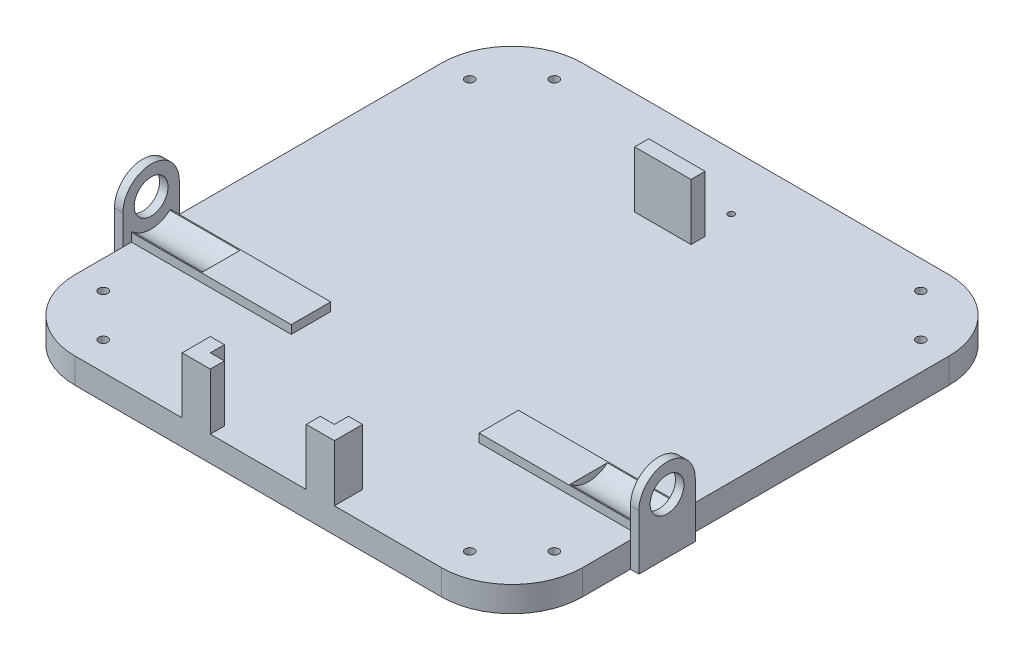
from build123d import *

# Parameters (mm, degrees)
PLATE_DEPTH          = 9
SKETCH2_R            = 1.09
CASTER_HOLES_DEPTH   = 128.597021909
SKETCH3_R            = 1.6
HEX_HOLES_DEPTH      = 128.597021909
SKETCH4_W            = 20
SKETCH4_H            = 5
BATTERY_HOLDER_DEPTH = 20
SKETCH5_W            = 56.7
SKETCH5_H            = 14
BOSS_EXTRUDE2_DEPTH  = 3
SKETCH6_R            = 10
CUT_EXTRUDE1_DEPTH   = 24.8
CUT_EXTRUDE2_START   = -24.8
SKETCH7_R            = 10
CUT_EXTRUDE2_DEPTH   = 24.8
SKETCH8_R            = 6
BOSS_EXTRUDE4_DEPTH  = 3
BOSS_EXTRUDE5_START  = 3
SKETCH9_R            = 6
BOSS_EXTRUDE5_DEPTH  = 3


with BuildPart() as part:
    # Sketch1 → Plate (new body)
    with BuildSketch(Plane(origin=(0, 0, 0), x_dir=(1, 0, 0), z_dir=(0, 1, 0))):
        with BuildLine():
            Line((-65, -90), (65, -90))
            ThreePointArc((65, -90), (82.67766953, -82.67766953), (90, -65))
            Line((90, -65), (90, 65))
            ThreePointArc((90, 65), (82.67766953, 82.67766953), (65, 90))
            Line((65, 90), (-65, 90))
            ThreePointArc((-65, 90), (-82.67766953, 82.67766953), (-90, 65))
            Line((-90, 65), (-90, -65))
            ThreePointArc((-90, -65), (-82.67766953, -82.67766953), (-65, -90))
        make_face()
    extrude(amount=PLATE_DEPTH)

    # Sketch2 → Caster Holes (cut, through all)
    with BuildSketch(Plane(origin=(0, 9, 0), x_dir=(1, 0, 0), z_dir=(0, 1, 0))):
        with Locations((-7.747, 70)):
            Circle(SKETCH2_R)
        with Locations((7.747, 70)):
            Circle(SKETCH2_R)
    extrude(amount=-CASTER_HOLES_DEPTH, mode=Mode.SUBTRACT)

    # Sketch3 → Hex Holes (cut, through all)
    with BuildSketch(Plane(origin=(0, 9, 0), x_dir=(1, 0, 0), z_dir=(0, 1, 0))):
        with Locations((-65, 80)):
            Circle(SKETCH3_R)
        with Locations((-80, 65)):
            Circle(SKETCH3_R)
        with Locations((80, 65)):
            Circle(SKETCH3_R)
        with Locations((80, -65)):
            Circle(SKETCH3_R)
        with Locations((65, 80)):
            Circle(SKETCH3_R)
        with Locations((65, -80)):
            Circle(SKETCH3_R)
        with Locations((-65, -80)):
            Circle(SKETCH3_R)
        with Locations((-80, -65)):
            Circle(SKETCH3_R)
    extrude(amount=-HEX_HOLES_DEPTH, mode=Mode.SUBTRACT)

    # Sketch4 → Battery Holder (add)
    with BuildSketch(Plane(origin=(0, 9, 0), x_dir=(1, 0, 0), z_dir=(0, 1, 0))):
        Polygon((-27, -90), (-27, -80), (-22, -80), (-22, -85), (-17, -85), (-17, -90), align=None)
        Polygon((17, -90), (17, -85), (22, -85), (22, -80), (27, -80), (27, -90), align=None)
        with Locations((0, 56)):
            Rectangle(SKETCH4_W, SKETCH4_H)
    extrude(amount=BATTERY_HOLDER_DEPTH)

    # Sketch5 → Boss-Extrude2 (add)
    with BuildSketch(Plane(origin=(0, 9, 0), x_dir=(1, 0, 0), z_dir=(0, 1, 0))):
        with Locations((-61.65, -38)):
            Rectangle(SKETCH5_W, SKETCH5_H)
        with Locations((61.65, -38)):
            Rectangle(SKETCH5_W, SKETCH5_H)
    extrude(amount=BOSS_EXTRUDE2_DEPTH)

    # Sketch6 → Cut-Extrude1 (cut)
    with BuildSketch(Plane.ZY.offset(90)):
        with Locations((38, 19.5)):
            Circle(SKETCH6_R)
    extrude(amount=-CUT_EXTRUDE1_DEPTH, mode=Mode.SUBTRACT)

    # Sketch7 → Cut-Extrude2 (cut)
    with BuildSketch(Plane(origin=(90, 0, 0), x_dir=(0, 0, -1), z_dir=(1, 0, 0)).offset(CUT_EXTRUDE2_START)):
        with Locations((-38, 19.5)):
            Circle(SKETCH7_R)
    extrude(amount=CUT_EXTRUDE2_DEPTH, mode=Mode.SUBTRACT)

    # Sketch8 → Boss-Extrude4 (add)
    with BuildSketch(Plane(origin=(90, 0, 0), x_dir=(0, 0, -1), z_dir=(1, 0, 0))):
        with BuildLine():
            Line((-48, 19.5), (-48, 0))
            Line((-48, 0), (-28, 0))
            Line((-28, 0), (-28, 19.5))
            ThreePointArc((-28, 19.5), (-38, 29.5), (-48, 19.5))
        make_face()
        with Locations((-38, 19.5)):
            Circle(SKETCH8_R, mode=Mode.SUBTRACT)
    extrude(amount=BOSS_EXTRUDE4_DEPTH)

    # Sketch9 → Boss-Extrude5 (add)
    with BuildSketch(Plane.ZY.offset(90).offset(BOSS_EXTRUDE5_START)):
        with BuildLine():
            Line((28, 19.5), (28, 0))
            Line((28, 0), (48, 0))
            Line((48, 0), (48, 19.5))
            ThreePointArc((48, 19.5), (38, 29.5), (28, 19.5))
        make_face()
        with Locations((38, 19.5)):
            Circle(SKETCH9_R, mode=Mode.SUBTRACT)
    extrude(amount=-BOSS_EXTRUDE5_DEPTH)


solid = part.part
